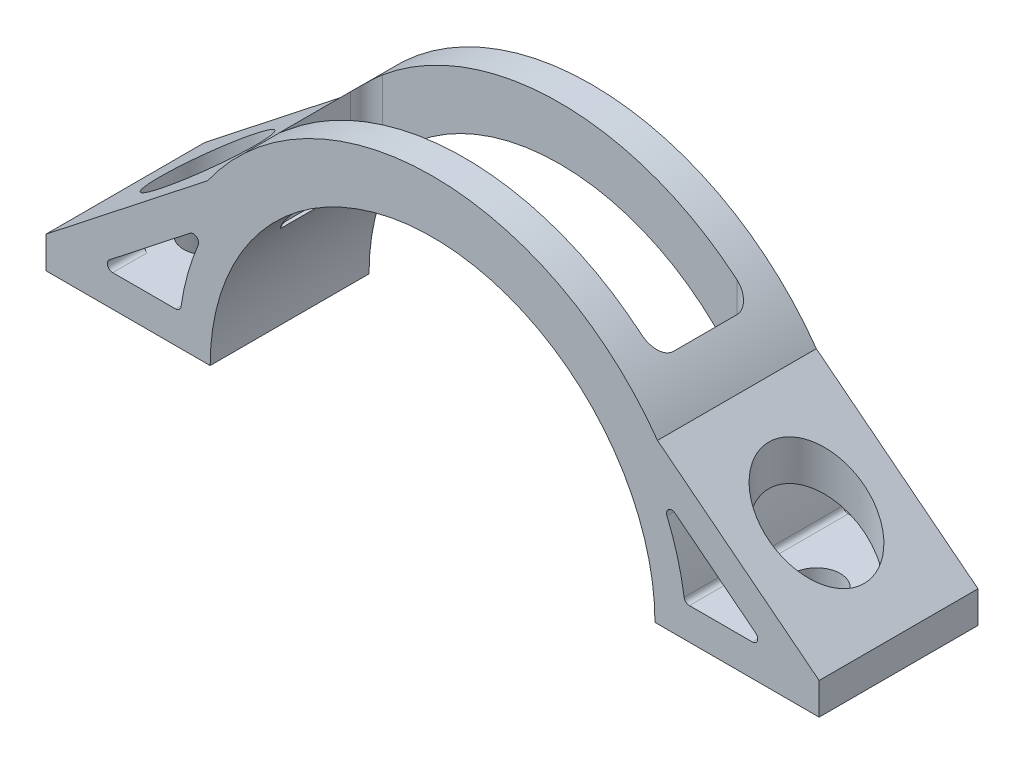
from build123d import *

# Parameters (mm, degrees)
SALIENTE_EXTRUIR1_DEPTH = 7.5
SALIENTE_EXTRUIR2_DEPTH = 7.5
CROQUIS3_R              = 2.25
CORTAR_EXTRUIR1_DEPTH   = 46.436769251
CROQUIS4_R              = 4.5
CORTAR_EXTRUIR2_DEPTH   = 44.789268092
CORTAR_EXTRUIR3_DEPTH   = 48.257274572
CORTAR_EXTRUIR4_DEPTH   = 15


with BuildPart() as part:
    # Croquis1 → Saliente-Extruir1 (new, symmetric)
    with BuildSketch(Plane.XY):
        with BuildLine():
            Line((-26, 0), (-21, 0))
            ThreePointArc((-21, 0), (0, 21), (21, 0))
            Line((21, 0), (26, 0))
            ThreePointArc((26, 0), (0, 26), (-26, 0))
        make_face()
    extrude(amount=SALIENTE_EXTRUIR1_DEPTH, both=True)

    # Croquis2 → Saliente-Extruir2 (add, symmetric)
    with BuildSketch(Plane.XY):
        with BuildLine():
            Line((26, 0), (36.5, 0))
            Line((36.5, 0), (36.5, 3))
            Line((36.5, 3), (21.236760582, 15))
            ThreePointArc((21.236760582, 15), (24.78059498, 7.869060455), (26, 0))
        make_face()
    saliente_extruir2 = extrude(amount=SALIENTE_EXTRUIR2_DEPTH, both=True)

    # Croquis3 → Cortar-Extruir1 (cut, through all)
    with BuildSketch(Plane.XZ):
        with Locations((28.75, 0)):
            Circle(CROQUIS3_R)
    cortar_extruir1 = extrude(amount=-CORTAR_EXTRUIR1_DEPTH, mode=Mode.SUBTRACT)

    # Croquis4 → Cortar-Extruir2 (cut, through all)
    with BuildSketch(Plane(origin=(0, 3, 0), x_dir=(-1, 0, 0), z_dir=(0, -1, 0))):
        with Locations((-28.75, 0)):
            Circle(CROQUIS4_R)
    cortar_extruir2 = extrude(amount=-CORTAR_EXTRUIR2_DEPTH, mode=Mode.SUBTRACT)

    # Simetría1: Saliente-Extruir2 across plane
    add(saliente_extruir2.mirror(Plane(origin=(0, 0, 0), x_dir=(0, 0, 1), z_dir=(1, 0, 0))))

    # Croquis6 → Cortar-Extruir3 (cut, through all)
    with BuildSketch(Plane.XY.offset(7.5)):
        with BuildLine():
            Line((30.510170652, 3.893065888), (22.898948379, 9.877029369))
            ThreePointArc((22.898948379, 9.877029369), (22.28692582, 9.881701061), (22.128900164, 9.290413206))
            ThreePointArc((22.128900164, 9.290413206), (23.12783497, 6.411181608), (23.753839647, 3.428571429))
            ThreePointArc((23.753839647, 3.428571429), (23.921384471, 3.122035527), (24.248711306, 3))
            Line((24.248711306, 3), (30.201141191, 3))
            ThreePointArc((30.201141191, 3), (30.673652007, 3.336496092), (30.510170652, 3.893065888))
        make_face()
    cortar_extruir3 = extrude(amount=-CORTAR_EXTRUIR3_DEPTH, mode=Mode.SUBTRACT)

    # Croquis8 → Cortar-Extruir4 (cut)
    with BuildSketch(Plane(origin=(0, 26, 0), x_dir=(1, 0, 0), z_dir=(0, 1, 0))):
        with BuildLine():
            Line((-16.736760582, -4.5), (16.736760582, -4.5))
            ThreePointArc((16.736760582, -4.5), (17.797420753, -4.060660172), (18.236760582, -3))
            Line((18.236760582, -3), (18.236760582, 3))
            ThreePointArc((18.236760582, 3), (17.797420753, 4.060660172), (16.736760582, 4.5))
            Line((16.736760582, 4.5), (-16.736760582, 4.5))
            ThreePointArc((-16.736760582, 4.5), (-17.797420753, 4.060660172), (-18.236760582, 3))
            Line((-18.236760582, 3), (-18.236760582, -3))
            ThreePointArc((-18.236760582, -3), (-17.797420753, -4.060660172), (-16.736760582, -4.5))
        make_face()
    extrude(amount=-CORTAR_EXTRUIR4_DEPTH, mode=Mode.SUBTRACT)

    # Simetría2: Cortar-Extruir1, Cortar-Extruir2, Cortar-Extruir3 across plane
    add(cortar_extruir1.mirror(Plane(origin=(0, 0, 0), x_dir=(0, 0, 1), z_dir=(1, 0, 0))), mode=Mode.SUBTRACT)
    add(cortar_extruir2.mirror(Plane(origin=(0, 0, 0), x_dir=(0, 0, 1), z_dir=(1, 0, 0))), mode=Mode.SUBTRACT)
    add(cortar_extruir3.mirror(Plane(origin=(0, 0, 0), x_dir=(0, 0, 1), z_dir=(1, 0, 0))), mode=Mode.SUBTRACT)


solid = part.part
